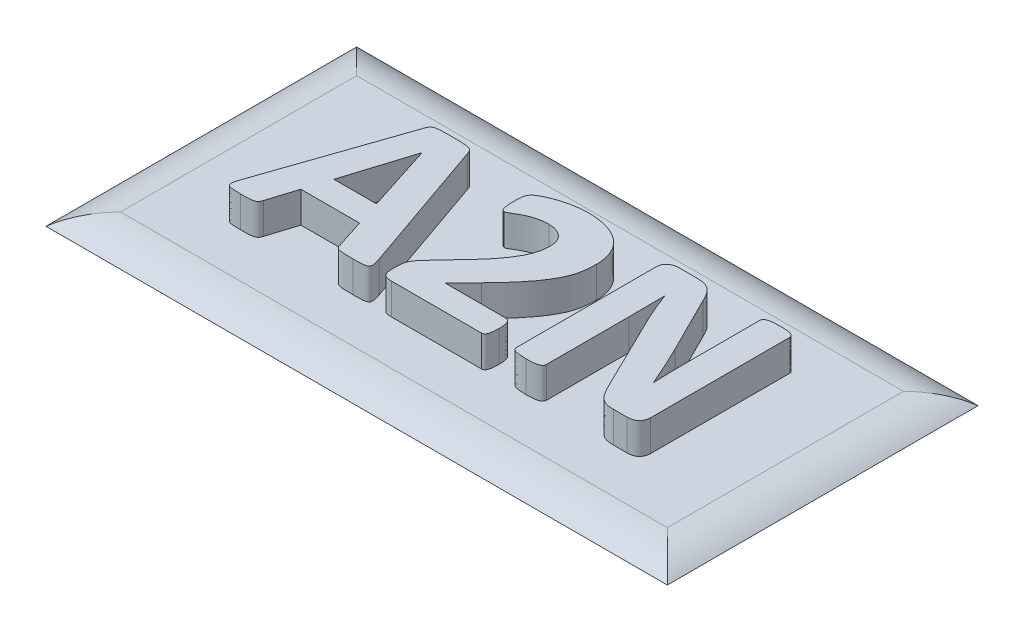
from build123d import *

# Parameters (mm, degrees)
SKETCH1_W           = 100
SKETCH1_H           = 50
BOSS_EXTRUDE1_DEPTH = 2
FILLET1_R           = 10
BOSS_EXTRUDE2_DEPTH = 5


with BuildPart() as part:
    # Sketch1 → Boss-Extrude1 (new body)
    with BuildSketch(Plane(origin=(0, 0, 0), x_dir=(1, 0, 0), z_dir=(0, 1, 0))):
        Rectangle(SKETCH1_W, SKETCH1_H)
    extrude(amount=BOSS_EXTRUDE1_DEPTH)

    # Fillet1
    # the kernel refuses this fillet: 10 mm, written as the material it takes off along each edge
    with BuildSketch(Plane(origin=(65, 2, 25), x_dir=(0, -1, 0), z_dir=(-1, 0, 0)), Plane(origin=(-65, 2, -25), x_dir=(0, -1, 0), z_dir=(1, 0, 0))) as fillet1_piece_1:
        with BuildLine():
            CenterArc((10, -6), FILLET1_R, 143.130102354, 36.869897646)
            Line((0, -6), (-0.2, -6))
            Line((-0.2, -6), (-0.2, 0))
            Line((-0.2, 0), (0, 0.2))
            ThreePointArc((0, 0.2), (1, 0.2), (1.84, 0.12))
            Line((1.84, 0.12), (2, 0))
        make_face()
    extrude(amount=130, mode=Mode.SUBTRACT)
    with BuildSketch(Plane(origin=(-50, 2, 40), x_dir=(0, -1, 0), z_dir=(0, 0, -1)), Plane(origin=(50, 2, -40), x_dir=(0, -1, 0), z_dir=(0, 0, 1))) as fillet1_piece_2:
        with BuildLine():
            CenterArc((10, -6), FILLET1_R, 143.130102354, 36.869897646)
            Line((0, -6), (-0.2, -6))
            Line((-0.2, -6), (-0.2, 0))
            Line((-0.2, 0), (0, 0.2))
            ThreePointArc((0, 0.2), (1, 0.2), (1.84, 0.12))
            Line((1.84, 0.12), (2, 0))
        make_face()
    extrude(amount=80, mode=Mode.SUBTRACT)

    # Sketch2 → Boss-Extrude2 (add)
    # profile 1 of 3: a face of its own
    with BuildSketch(Plane(origin=(0, 2, 0), x_dir=(1, 0, 0), z_dir=(0, 1, 0))):
        with BuildLine():
            add(Edge.make_bspline(
                [(-11.601299659, -9.841584589), (-11.563585155, -9.950316275), (-11.49327837, -10.153012171), (-11.413534821, -10.445635978), (-11.349661267, -10.699936176), (-11.306118205, -10.921682805), (-11.289738261, -11.113723598), (-11.313986221, -11.279352455), (-11.363462255, -11.425691617), (-11.461495917, -11.543060662), (-11.593317118, -11.63871132), (-11.768373798, -11.703985364), (-11.97909148, -11.762626507), (-12.234339451, -11.793675702), (-12.533788163, -11.806039593), (-12.880151481, -11.827722916), (-13.280636287, -11.828383134), (-13.564011115, -11.832645715), (-13.715270247, -11.834920986)],
                knots=[0, 0, 0, 0, 1.351975101, 2.52033068, 3.562719996, 4.432170766, 5.176088948, 5.812532786, 6.389296298, 6.965620705, 7.577732788, 8.283941723, 9.146375963, 10.145613058, 11.295182858, 12.669444765, 14.222224263, 16, 16, 16, 16], degree=3))
            add(Edge.make_bspline(
                [(-13.715270247, -11.834920986), (-13.870369286, -11.835290209), (-14.163347433, -11.835987663), (-14.575136171, -11.831413069), (-14.933085117, -11.817643072), (-15.316850409, -11.807123942), (-15.701316836, -11.77053698), (-16.071005701, -11.710223292), (-16.336308228, -11.609183412), (-16.516997938, -11.460163732), (-16.620143845, -11.263072627), (-16.669885082, -11.123208071), (-16.696658115, -11.047926501)],
                knots=[0, 0, 0, 0, 1.402041787, 2.648421349, 3.722147351, 4.640185661, 6.117966101, 7.211050041, 8.017924191, 8.656254393, 9.276733986, 10, 10, 10, 10], degree=3))
            Line((-16.696658115, -11.047926501), (-18.224691203, -6.320215104))
            Line((-18.224691203, -6.320215104), (-27.657136056, -6.320215104))
            Line((-27.657136056, -6.320215104), (-29.10474635, -10.915803339))
            add(Edge.make_bspline(
                [(-29.10474635, -10.915803339), (-29.130945567, -10.998971674), (-29.180836517, -11.157348445), (-29.294127354, -11.376104523), (-29.476596599, -11.548611379), (-29.733868763, -11.678128206), (-30.089168414, -11.755857894), (-30.554341549, -11.812375901), (-31.157468754, -11.825217817), (-31.605566823, -11.831439105), (-31.856354806, -11.834920986)],
                knots=[0, 0, 0, 0, 0.662368552, 1.261342941, 1.847645799, 2.537239812, 3.42265718, 4.595262896, 6.094463672, 8, 8, 8, 8], degree=3))
            add(Edge.make_bspline(
                [(-31.856354806, -11.834920986), (-31.996143585, -11.833479807), (-32.260449049, -11.830754901), (-32.633949917, -11.819722933), (-32.959516683, -11.80229869), (-33.240138667, -11.782849061), (-33.475481079, -11.744750783), (-33.67339203, -11.686771407), (-33.833393588, -11.610413167), (-33.998075141, -11.475764115), (-34.10729175, -11.214748569), (-34.094613507, -10.830913772), (-33.973338968, -10.355254563), (-33.861412083, -10.001705222), (-33.797990836, -9.801373192)],
                knots=[0, 0, 0, 0, 1.279822224, 2.419822313, 3.420424811, 4.264789446, 4.993926375, 5.598399463, 6.14718048, 6.607326483, 7.517039103, 8.604050794, 10.075749779, 12, 12, 12, 12], degree=3))
            Line((-33.797990836, -9.801373192), (-26.238248188, 12.171283058))
            add(Edge.make_bspline(
                [(-26.238248188, 12.171283058), (-26.198748628, 12.270040151), (-26.125703921, 12.452667065), (-25.980195357, 12.701990812), (-25.761914495, 12.896723262), (-25.444389601, 13.016973015), (-25.029271606, 13.107955595), (-24.601512323, 13.135758534), (-24.189429405, 13.148001714), (-23.816068317, 13.161272513), (-23.394743192, 13.166219864), (-23.097930291, 13.165473727), (-22.94091363, 13.165079014)],
                knots=[0, 0, 0, 0, 0.856868194, 1.584566637, 2.305859304, 3.162727498, 4.285524966, 5.725550839, 6.605441018, 7.608682037, 8.734971556, 10, 10, 10, 10], degree=3))
            add(Edge.make_bspline(
                [(-22.94091363, 13.165079014), (-22.760919071, 13.165457339), (-22.418152213, 13.16617779), (-21.933646314, 13.161378166), (-21.50665551, 13.148136557), (-21.04103815, 13.135543858), (-20.563758508, 13.109058687), (-20.100494154, 13.017405631), (-19.751657668, 12.894811892), (-19.508594308, 12.691336445), (-19.350552122, 12.423004566), (-19.279823448, 12.222550596), (-19.2414651, 12.113838205)],
                knots=[0, 0, 0, 0, 1.298203691, 2.47219252, 3.494555852, 4.378870695, 5.833194716, 6.932857721, 7.781737059, 8.467837287, 9.169060755, 10, 10, 10, 10], degree=3))
            Line((-19.2414651, 12.113838205), (-11.601299659, -9.841584589))
        make_face()
        Polygon((-22.998358483, 8.49481247), (-23.015591938, 8.49481247), (-26.387604806, -2.276097456), (-19.528689365, -2.276097456), align=None, mode=Mode.SUBTRACT)
    # profile 2 of 3: a face of its own
    with BuildSketch(Plane(origin=(0, 2, 0), x_dir=(1, 0, 0), z_dir=(0, 1, 0))):
        with BuildLine():
            add(Edge.make_bspline(
                [(7.700170929, -9.801373192), (7.699311137, -9.971970921), (7.697723835, -10.286919144), (7.653560244, -10.719700796), (7.604503946, -11.080067587), (7.517000576, -11.365293741), (7.415050159, -11.590492401), (7.263009872, -11.738008923), (7.08640912, -11.816023153), (6.963648929, -11.828582058), (6.901687473, -11.834920986)],
                knots=[0, 0, 0, 0, 1.700477232, 3.139328327, 4.338937117, 5.31779253, 6.112293145, 6.774269824, 7.381330181, 8, 8, 8, 8], degree=3))
            Line((6.901687473, -11.834920986), (-7.591648924, -11.834920986))
            add(Edge.make_bspline(
                [(-7.591648924, -11.834920986), (-7.725814049, -11.832128703), (-7.976457197, -11.826912246), (-8.326575375, -11.77617844), (-8.623193093, -11.661424322), (-8.864302214, -11.466646006), (-9.033002699, -11.175728513), (-9.144582615, -10.793009885), (-9.199505144, -10.302696723), (-9.207286016, -9.939346896), (-9.211593777, -9.738183854)],
                knots=[0, 0, 0, 0, 1.025949817, 1.916647791, 2.69162005, 3.43032923, 4.23901448, 5.220859075, 6.461371377, 8, 8, 8, 8], degree=3))
            add(Edge.make_bspline(
                [(-9.211593777, -9.738183854), (-9.207552087, -9.542835441), (-9.200092908, -9.182308228), (-9.165293034, -8.678119702), (-9.086454354, -8.243260732), (-8.957487078, -7.855638736), (-8.771690171, -7.505184134), (-8.555443724, -7.152677519), (-8.269222405, -6.798725138), (-8.052594559, -6.56210977), (-7.936318041, -6.435104809)],
                knots=[0, 0, 0, 0, 1.279770231, 2.361892714, 3.306414937, 4.167028953, 5.025172171, 5.898575693, 6.872045744, 8, 8, 8, 8], degree=3))
            Line((-7.936318041, -6.435104809), (-3.679654438, -1.862494515))
            add(Edge.make_bspline(
                [(-3.679654438, -1.862494515), (-3.47737874, -1.641467981), (-3.086222429, -1.214051713), (-2.540002082, -0.577827539), (-2.057471868, 0.029941168), (-1.635647903, 0.607944789), (-1.264187846, 1.158109549), (-0.940166305, 1.682249808), (-0.653416271, 2.18074348), (-0.341391709, 2.797005739), (-0.039832336, 3.522028953), (0.196628882, 4.354103338), (0.320525014, 5.126554961), (0.338546687, 5.62411), (0.347229753, 5.863838205)],
                knots=[0, 0, 0, 0, 1.20947157, 2.338849612, 3.384319872, 4.341377303, 5.226828348, 6.063423144, 6.828539773, 7.547598628, 8.851019864, 9.991402106, 11.032232556, 12, 12, 12, 12], degree=3))
            add(Edge.make_bspline(
                [(0.347229753, 5.863838205), (0.337054104, 6.056307198), (0.316896433, 6.437582812), (0.163737255, 6.985952131), (-0.083044563, 7.490603979), (-0.44109828, 7.924963296), (-0.891547457, 8.29246219), (-1.451088247, 8.554223066), (-2.109118246, 8.725987331), (-2.583150212, 8.743827734), (-2.8352151, 8.753314308)],
                knots=[0, 0, 0, 0, 0.952592796, 1.887059298, 2.799298945, 3.716508085, 4.654435942, 5.655858967, 6.753510967, 8, 8, 8, 8], degree=3))
            add(Edge.make_bspline(
                [(-2.8352151, 8.753314308), (-3.019142198, 8.750067961), (-3.37627641, 8.743764477), (-3.897327178, 8.693177176), (-4.384425996, 8.600125154), (-4.977653528, 8.442017246), (-5.644889534, 8.195020815), (-6.354762928, 7.862675141), (-6.954733278, 7.5270942), (-7.387183422, 7.266196824), (-7.674970235, 7.076669294), (-7.862678949, 6.993677665), (-8.021830803, 6.926566314), (-8.125388401, 6.918636255), (-8.171841938, 6.915079014)],
                knots=[0, 0, 0, 0, 1.155956231, 2.244538859, 3.28550842, 4.269318886, 6.100628768, 7.748195433, 9.191883973, 10.417953324, 10.925724687, 11.351067817, 11.708904068, 12, 12, 12, 12], degree=3))
            add(Edge.make_bspline(
                [(-8.171841938, 6.915079014), (-8.226944753, 6.920007728), (-8.337928184, 6.929934726), (-8.486594627, 7.036316391), (-8.602892627, 7.207922335), (-8.684780073, 7.458017574), (-8.74929027, 7.789875434), (-8.807072597, 8.215538274), (-8.838519515, 8.741364131), (-8.842033396, 9.124751451), (-8.843946718, 9.333507323)],
                knots=[0, 0, 0, 0, 0.485692822, 0.97824142, 1.565816375, 2.311318477, 3.305989244, 4.581102635, 6.138397226, 8, 8, 8, 8], degree=3))
            add(Edge.make_bspline(
                [(-8.843946718, 9.333507323), (-8.843867038, 9.475267937), (-8.843722614, 9.732214215), (-8.818511837, 10.086662343), (-8.787354788, 10.382807213), (-8.735680195, 10.635050915), (-8.666414907, 10.850780676), (-8.575692921, 11.051448476), (-8.430092033, 11.251536277), (-8.265345749, 11.432295261), (-8.073986595, 11.592602738), (-7.873476625, 11.733308648), (-7.623551143, 11.890889134), (-7.197888586, 12.118895882), (-6.56833587, 12.425089397), (-5.693273627, 12.756089847), (-4.698367286, 13.062538684), (-3.604952602, 13.32228214), (-2.435008748, 13.501774613), (-1.629543783, 13.522310395), (-1.221014733, 13.532726073)],
                knots=[0, 0, 0, 0, 0.788292368, 1.428808632, 1.975788089, 2.443732868, 2.858052408, 3.234493626, 3.66294862, 4.228288178, 4.591069522, 5.049213324, 5.590039132, 6.233559628, 7.734267659, 9.480939635, 11.431700141, 13.521863135, 15.728704436, 18, 18, 18, 18], degree=3))
            add(Edge.make_bspline(
                [(-1.221014733, 13.532726073), (-0.902902571, 13.528079213), (-0.286315003, 13.519072341), (0.608670463, 13.424959413), (1.441964166, 13.274637607), (2.211308099, 13.05286099), (2.918582051, 12.783939434), (3.567582516, 12.469221334), (4.150538118, 12.099947017), (4.672034276, 11.683177941), (5.131406182, 11.225264008), (5.530040412, 10.722890529), (5.860742526, 10.177473287), (6.133139944, 9.593976214), (6.337473472, 8.977882441), (6.485820012, 8.339456993), (6.583196749, 7.678245522), (6.592499292, 7.229459582), (6.597229753, 7.001246294)],
                knots=[0, 0, 0, 0, 1.324900052, 2.568015312, 3.744666331, 4.8481595, 5.898614886, 6.894039723, 7.847934722, 8.767415271, 9.669989851, 10.544631889, 11.43259769, 12.321315746, 13.221949113, 14.131442766, 15.049815173, 16, 16, 16, 16], degree=3))
            add(Edge.make_bspline(
                [(6.597229753, 7.001246294), (6.585985871, 6.596655929), (6.563555835, 5.789552401), (6.416842914, 4.784137798), (6.231605446, 3.977168074), (6.016760541, 3.354074809), (5.755586698, 2.702350077), (5.416245525, 2.030403227), (5.017247018, 1.323950886), (4.545010642, 0.584232729), (3.997659725, -0.19121347), (3.37089158, -1.005846735), (2.658001576, -1.875127307), (1.841822875, -2.804263135), (0.914623016, -3.796612906), (0.254705427, -4.473661105), (-0.08935113, -4.826648927)],
                knots=[0, 0, 0, 0, 1.214695824, 2.423155294, 3.043825433, 3.698462194, 4.400034292, 5.150962269, 5.956941602, 6.835925221, 7.785176393, 8.806499493, 9.921972916, 11.160753287, 12.51972206, 14, 14, 14, 14], degree=3))
            Line((-0.08935113, -4.826648927), (-2.961593777, -7.790803339))
            Line((-2.961593777, -7.790803339), (6.838498135, -7.790803339))
            add(Edge.make_bspline(
                [(6.838498135, -7.790803339), (6.900962211, -7.796100453), (7.026394472, -7.806737432), (7.200261154, -7.904404678), (7.359816034, -8.049768958), (7.484467944, -8.269208367), (7.589341781, -8.549251528), (7.649445202, -8.905266153), (7.698668753, -9.328935766), (7.699646654, -9.636487658), (7.700170929, -9.801373192)],
                knots=[0, 0, 0, 0, 0.620001289, 1.24500623, 1.94939785, 2.757032326, 3.738367869, 4.928457297, 6.353276405, 8, 8, 8, 8], degree=3))
        make_face()
    # profile 3 of 3: a face of its own
    with BuildSketch(Plane(origin=(0, 2, 0), x_dir=(1, 0, 0), z_dir=(0, 1, 0))):
        with BuildLine():
            add(Edge.make_bspline(
                [(32.33252387, -10.025408118), (32.325702141, -10.166252027), (32.312526275, -10.438285727), (32.186675001, -10.815312303), (32.001679164, -11.139218575), (31.75439081, -11.402580161), (31.455569159, -11.608773307), (31.110530713, -11.742457261), (30.742401149, -11.814969297), (30.492666994, -11.828274329), (30.3679099, -11.834920986)],
                knots=[0, 0, 0, 0, 1.120032347, 2.163292293, 3.135130692, 4.07524891, 5.019946156, 6.00690811, 7.004331812, 8, 8, 8, 8], degree=3))
            Line((30.3679099, -11.834920986), (28.139049606, -11.834920986))
            add(Edge.make_bspline(
                [(28.139049606, -11.834920986), (27.922345925, -11.828930456), (27.518595272, -11.817769222), (26.94371334, -11.719515347), (26.435534363, -11.510757992), (25.975281427, -11.187844962), (25.550554861, -10.741832825), (25.147257766, -10.161891853), (24.740153096, -9.435265098), (24.475009634, -8.895209249), (24.330455856, -8.600775765)],
                knots=[0, 0, 0, 0, 0.966254035, 1.800272596, 2.585200708, 3.395271146, 4.288963202, 5.317323791, 6.537429596, 8, 8, 8, 8], degree=3))
            Line((24.330455856, -8.600775765), (18.499803282, 3.324775705))
            add(Edge.make_bspline(
                [(18.499803282, 3.324775705), (18.328064543, 3.691814936), (17.972824193, 4.451032948), (17.457702999, 5.618922789), (16.972163423, 6.817363208), (16.671288114, 7.622887799), (16.523700341, 8.018020191)],
                knots=[0, 0, 0, 0, 0.954558477, 1.974497353, 3.006434174, 4, 4, 4, 4], degree=3))
            Line((16.523700341, 8.018020191), (16.483488944, 8.018020191))
            add(Edge.make_bspline(
                [(16.483488944, 8.018020191), (16.49432644, 7.546993168), (16.515955507, 6.606935109), (16.525787872, 5.191745035), (16.523156046, 3.75752798), (16.523516999, 2.792453755), (16.523700341, 2.302257323)],
                knots=[0, 0, 0, 0, 0.989090355, 1.973989423, 2.970915262, 4, 4, 4, 4], degree=3))
            Line((16.523700341, 2.302257323), (16.523700341, -10.990481648))
            add(Edge.make_bspline(
                [(16.523700341, -10.990481648), (16.517901153, -11.052627011), (16.506096375, -11.179129591), (16.415234346, -11.358092668), (16.251357278, -11.509657817), (16.011144372, -11.628726215), (15.683123806, -11.714586611), (15.261131171, -11.791190627), (14.72226663, -11.823594224), (14.325466858, -11.830878658), (14.105272032, -11.834920986)],
                knots=[0, 0, 0, 0, 0.533239368, 1.085457576, 1.679302583, 2.423102222, 3.366158425, 4.586936804, 6.105999776, 8, 8, 8, 8], degree=3))
            add(Edge.make_bspline(
                [(14.105272032, -11.834920986), (13.890807844, -11.830980996), (13.49973079, -11.823796394), (12.968978363, -11.789612902), (12.548682941, -11.720012009), (12.22399075, -11.637849936), (11.994946346, -11.512918487), (11.833786821, -11.371323426), (11.756569393, -11.192322434), (11.748402103, -11.069550341), (11.744288576, -11.007715104)],
                knots=[0, 0, 0, 0, 1.880338663, 3.428811631, 4.65383513, 5.615149483, 6.343797838, 6.92541045, 7.458773589, 8, 8, 8, 8], degree=3))
            Line((11.744288576, -11.007715104), (11.744288576, 11.355566146))
            add(Edge.make_bspline(
                [(11.744288576, 11.355566146), (11.750020504, 11.498004987), (11.760885267, 11.767995148), (11.865810756, 12.145000391), (12.040080077, 12.467056552), (12.290317265, 12.721014212), (12.5824744, 12.924071335), (12.917150159, 13.059107855), (13.277051019, 13.150358856), (13.528312486, 13.160088166), (13.657202179, 13.165079014)],
                knots=[0, 0, 0, 0, 1.146599659, 2.173358234, 3.127386818, 4.066803063, 5.022080866, 5.977233821, 6.962380843, 8, 8, 8, 8], degree=3))
            Line((13.657202179, 13.165079014), (16.494977914, 13.165079014))
            add(Edge.make_bspline(
                [(16.494977914, 13.165079014), (16.731031927, 13.162131073), (17.163483228, 13.156730441), (17.761886461, 13.05569057), (18.280471481, 12.897534298), (18.733034146, 12.634064488), (19.146212764, 12.278476207), (19.520241107, 11.811060541), (19.877023385, 11.23381767), (20.087487709, 10.800546385), (20.200170929, 10.568571661)],
                knots=[0, 0, 0, 0, 1.157819279, 2.121126641, 2.971782284, 3.805898374, 4.67303314, 5.635237899, 6.733899397, 8, 8, 8, 8], degree=3))
            Line((20.200170929, 10.568571661), (24.744058797, 1.475051441))
            add(Edge.make_bspline(
                [(24.744058797, 1.475051441), (24.876563778, 1.201413701), (25.138594227, 0.660291254), (25.522717119, -0.149959563), (25.913131095, -0.94502295), (26.27571153, -1.743010799), (26.633235699, -2.529388534), (26.977689949, -3.307774816), (27.318476047, -4.078642068), (27.54010533, -4.592866455), (27.650768356, -4.849626868)],
                knots=[0, 0, 0, 0, 1.048159491, 2.072750013, 3.091389825, 4.101587992, 5.094292605, 6.069547355, 7.0360943, 8, 8, 8, 8], degree=3))
            Line((27.650768356, -4.849626868), (27.668001812, -4.849626868))
            add(Edge.make_bspline(
                [(27.668001812, -4.849626868), (27.649298585, -4.393944036), (27.611114504, -3.463632323), (27.581205608, -2.057893958), (27.555106545, -0.656248496), (27.553765811, 0.270611774), (27.553112106, 0.722523867)],
                knots=[0, 0, 0, 0, 0.981864332, 2.004551901, 3.027073275, 4, 4, 4, 4], degree=3))
            Line((27.553112106, 0.722523867), (27.553112106, 12.343617617))
            add(Edge.make_bspline(
                [(27.553112106, 12.343617617), (27.558216624, 12.40422434), (27.568563576, 12.527075282), (27.672598234, 12.69793939), (27.844878262, 12.844973114), (28.094038736, 12.970196477), (28.4284883, 13.06500723), (28.857434751, 13.121364502), (29.394367051, 13.16265577), (29.79142966, 13.164214247), (30.011751812, 13.165079014)],
                knots=[0, 0, 0, 0, 0.513514522, 1.040903369, 1.654763982, 2.430140109, 3.402872071, 4.610164628, 6.119047709, 8, 8, 8, 8], degree=3))
            add(Edge.make_bspline(
                [(30.011751812, 13.165079014), (30.22251049, 13.164177561), (30.606200294, 13.16253645), (31.12768944, 13.120596311), (31.54393365, 13.067122853), (31.860509513, 12.972277794), (32.085051244, 12.844277862), (32.232367167, 12.693624562), (32.323170451, 12.52309458), (32.32937534, 12.400222029), (32.33252387, 12.337873132)],
                knots=[0, 0, 0, 0, 1.872486456, 3.408893843, 4.648537669, 5.595853804, 6.328496016, 6.918324485, 7.451128226, 8, 8, 8, 8], degree=3))
            Line((32.33252387, 12.337873132), (32.33252387, -10.025408118))
        make_face()
    extrude(amount=BOSS_EXTRUDE2_DEPTH)


solid = part.part
